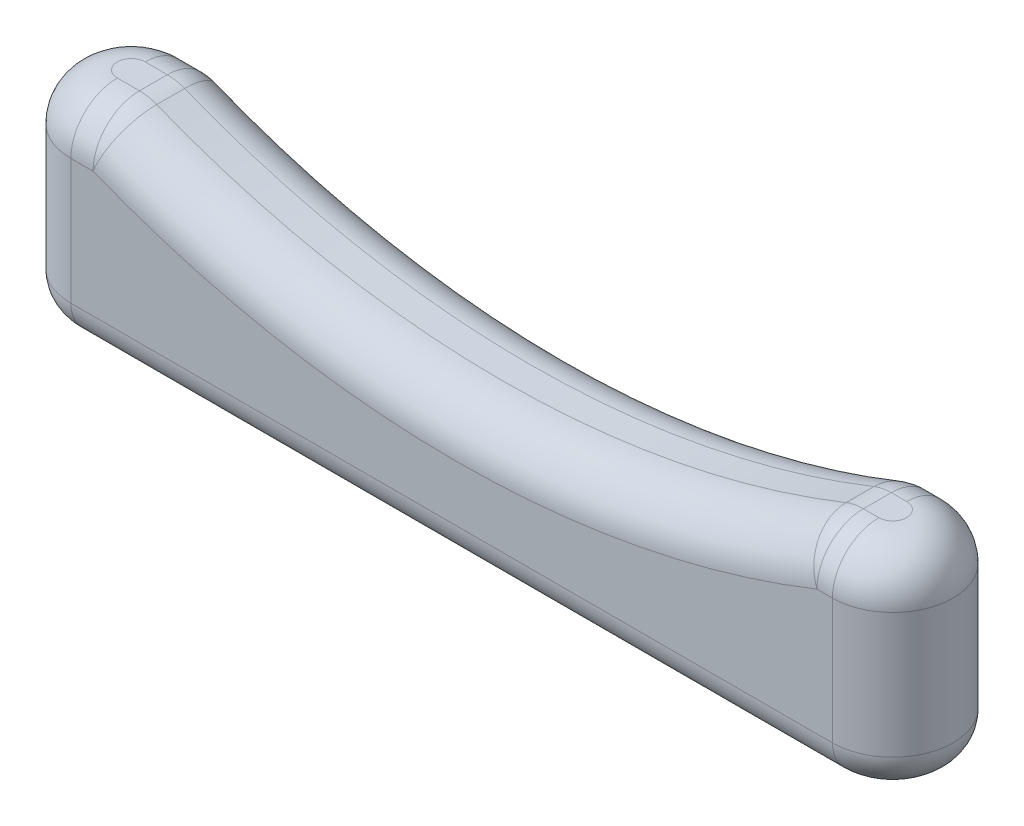
from build123d import *

# Parameters (mm, degrees)
BOSS_EXTRUDE1_DEPTH = 45
SKETCH2_R           = 11
CUT_EXTRUDE1_DEPTH  = 15
SKETCH4_R           = 200
CUT_EXTRUDE2_DEPTH  = 17.5
FILLET1_R           = 8
FILLET2_R           = 10
FILLET3_R           = 10


with BuildPart() as part:
    # Sketch1 → Boss-Extrude1 (new body)
    with BuildSketch(Plane(origin=(0, 0, 0), x_dir=(1, 0, 0), z_dir=(0, 1, 0))):
        with BuildLine():
            Line((-82, 13), (82, 13))
            ThreePointArc((82, 13), (95, 0), (82, -13))
            Line((82, -13), (-82, -13))
            ThreePointArc((-82, -13), (-95, 0), (-82, 13))
        make_face()
    extrude(amount=-BOSS_EXTRUDE1_DEPTH)

    # Sketch2 → Cut-Extrude1 (cut)
    with BuildSketch(Plane.XZ.offset(45)):
        with Locations(Location((-54, 0, 0), (0, 0, 270))):
            Circle(SKETCH2_R)
        with Locations(Location((54, 0, 0), (0, 0, 270))):
            Circle(SKETCH2_R)
    extrude(amount=-CUT_EXTRUDE1_DEPTH, mode=Mode.SUBTRACT)

    # Sketch4 → Cut-Extrude2 (cut, symmetric)
    with BuildSketch(Plane.XY):
        with Locations((0.724830201, 185)):
            Circle(SKETCH4_R)
    extrude(amount=CUT_EXTRUDE2_DEPTH, both=True, mode=Mode.SUBTRACT)

    # Fillet1
    # the kernel refuses this fillet: 8 mm, written as the material it takes off along each edge
    with BuildSketch(Plane(origin=(82, -45, 0), x_dir=(0, 0, -1), z_dir=(-1, 0, 0))) as fillet1_piece_1:
        with BuildLine():
            CenterArc((13 - FILLET1_R, -FILLET1_R), FILLET1_R, 0, 90)
            Line((13, -FILLET1_R), (13, 0))
            Line((13, 0), (13 - FILLET1_R, 0))
        make_face()
    revolve(axis=Axis((82, -45, 0), (0, -1, 0)), revolution_arc=180, mode=Mode.SUBTRACT)
    with BuildSketch(Plane(origin=(-82, -45, -13), x_dir=(0, 0, 1), z_dir=(1, 0, 0))) as fillet1_piece_2:
        with BuildLine():
            CenterArc((FILLET1_R, -FILLET1_R), FILLET1_R, 90, 90)
            Line((0, -FILLET1_R), (0, 0))
            Line((0, 0), (FILLET1_R, 0))
        make_face()
    extrude(amount=164, mode=Mode.SUBTRACT)
    with BuildSketch(Plane(origin=(-82, -45, 0), x_dir=(0, 0, 1), z_dir=(1, 0, 0))) as fillet1_piece_3:
        with BuildLine():
            CenterArc((13 - FILLET1_R, -FILLET1_R), FILLET1_R, 0, 90)
            Line((13 - FILLET1_R, 0), (13, 0))
            Line((13, 0), (13, -FILLET1_R))
        make_face()
    revolve(axis=Axis((-82, -45, 0), (0, -1, 0)), revolution_arc=180, mode=Mode.SUBTRACT)
    with BuildSketch(Plane(origin=(82, -45, 13), x_dir=(0, 1, 0), z_dir=(-1, 0, 0))) as fillet1_piece_4:
        with BuildLine():
            CenterArc((FILLET1_R, FILLET1_R), FILLET1_R, 180, 90)
            Line((0, FILLET1_R), (0, 0))
            Line((0, 0), (FILLET1_R, 0))
        make_face()
    extrude(amount=164, mode=Mode.SUBTRACT)

    # Fillet2
    # the kernel refuses this fillet: 10 mm, written as the material it takes off along each edge
    with BuildSketch(Plane(origin=(82, 0, 13), x_dir=(0, -1, 0), z_dir=(-1, 0, 0))) as fillet2_piece_1:
        with BuildLine():
            CenterArc((FILLET2_R, -FILLET2_R), FILLET2_R, 90, 90)
            Line((0, -FILLET2_R), (0, 0))
            Line((0, 0), (FILLET2_R, 0))
        make_face()
    extrude(amount=30.281749031, mode=Mode.SUBTRACT)
    with BuildSketch(Plane(origin=(-82, 0, -13), x_dir=(0, 0, 1), z_dir=(1, 0, 0))) as fillet2_piece_2:
        with BuildLine():
            CenterArc((FILLET2_R, FILLET2_R), FILLET2_R, 180, 90)
            Line((0, FILLET2_R), (0, 0))
            Line((0, 0), (FILLET2_R, 0))
        make_face()
    extrude(amount=31.731409434, mode=Mode.SUBTRACT)
    with BuildSketch(Plane(origin=(0.724830201, 185, -13), x_dir=(-0.49233736380683973, -0.8704044578239082, 0), z_dir=(-0.8704044578239082, 0.49233736380683973, 0))) as fillet2_piece_3:
        with BuildLine():
            CenterArc((200 + FILLET2_R, FILLET2_R), FILLET2_R, 180, 90)
            Line((200 + FILLET2_R, 0), (200, 0))
            Line((200, 0), (200, FILLET2_R))
        make_face()
    revolve(axis=Axis((0.724830201, 185, -13), (0, 0, 1)), revolution_arc=58.988651661, mode=Mode.SUBTRACT)
    with BuildSketch(Plane(origin=(0.724830201, 185, 13), x_dir=(-0.49233736380683973, -0.8704044578239082, 0), z_dir=(-0.8704044578239082, 0.49233736380683973, 0))) as fillet2_piece_4:
        with BuildLine():
            CenterArc((200 + FILLET2_R, -FILLET2_R), FILLET2_R, 90, 90)
            Line((200, -FILLET2_R), (200, 0))
            Line((200, 0), (200 + FILLET2_R, 0))
        make_face()
    revolve(axis=Axis((0.724830201, 185, 13), (0, 0, 1)), revolution_arc=58.988651661, mode=Mode.SUBTRACT)
    with BuildSketch(Plane(origin=(51.718250969, 0, -13), x_dir=(0, 0, 1), z_dir=(1, 0, 0))) as fillet2_piece_5:
        with BuildLine():
            CenterArc((FILLET2_R, FILLET2_R), FILLET2_R, 180, 90)
            Line((0, FILLET2_R), (0, 0))
            Line((0, 0), (FILLET2_R, 0))
        make_face()
    extrude(amount=30.281749031, mode=Mode.SUBTRACT)
    with BuildSketch(Plane(origin=(82, 0, 0), x_dir=(0, 0, -1), z_dir=(-1, 0, 0))) as fillet2_piece_6:
        with BuildLine():
            CenterArc((13 - FILLET2_R, FILLET2_R), FILLET2_R, 270, 90)
            Line((13, FILLET2_R), (13, 0))
            Line((13, 0), (13 - FILLET2_R, 0))
        make_face()
    revolve(axis=Axis((82, 0, 0), (0, -1, 0)), revolution_arc=180, mode=Mode.SUBTRACT)
    with BuildSketch(Plane(origin=(-50.268590566, 0, 13), x_dir=(0, -1, 0), z_dir=(-1, 0, 0))) as fillet2_piece_7:
        with BuildLine():
            CenterArc((FILLET2_R, -FILLET2_R), FILLET2_R, 90, 90)
            Line((0, -FILLET2_R), (0, 0))
            Line((0, 0), (FILLET2_R, 0))
        make_face()
    extrude(amount=31.731409434, mode=Mode.SUBTRACT)
    with BuildSketch(Plane(origin=(-82, 0, 0), x_dir=(0, 0, 1), z_dir=(1, 0, 0))) as fillet2_piece_8:
        with BuildLine():
            CenterArc((13 - FILLET2_R, FILLET2_R), FILLET2_R, 270, 90)
            Line((13, FILLET2_R), (13, 0))
            Line((13, 0), (13 - FILLET2_R, 0))
        make_face()
    revolve(axis=Axis((-82, 0, 0), (0, -1, 0)), revolution_arc=180, mode=Mode.SUBTRACT)

    # Fillet3
    fillet3_edges = [part.edges().sort_by_distance(p)[0] for p in [
        (-75.268590566, 0, 0),
        (76.718250969, 0, 0),
        (77.300565536, -2.961441402, 10.103428202),
        (-75.850905134, -2.961441403, 10.103428203),
        (77.300565536, -2.961441402, -10.103428202),
        (-75.850905134, -2.961441403, -10.103428203),
    ]]
    fillet(fillet3_edges, radius=FILLET3_R)


solid = part.part
